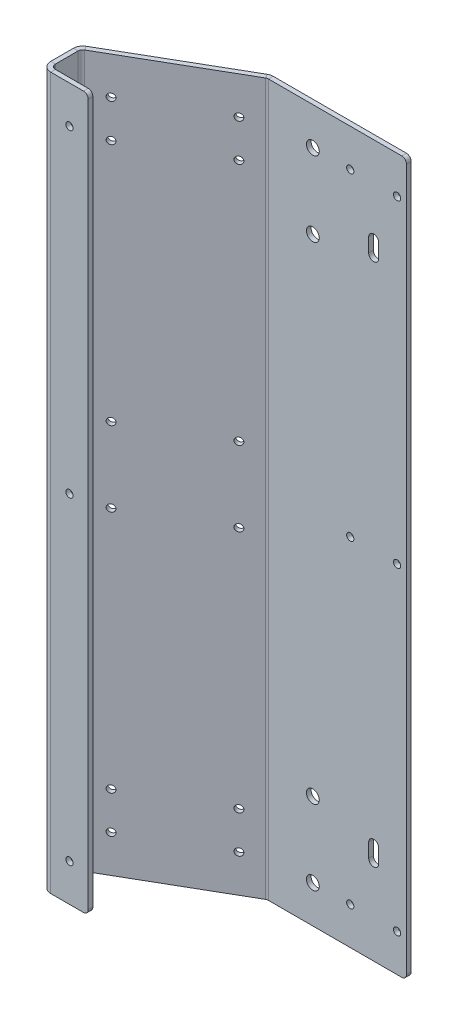
from build123d import *

# Parameters (mm, degrees)
BASE_FLANGE1_DEPTH = 482.6
SKETCH2_R          = 2.45745
CUT_EXTRUDE1_DEPTH = 3.175
SKETCH3_R          = 2.45745
CUT_EXTRUDE2_DEPTH = 3.175
SKETCH4_R          = 2.45745
CUT_EXTRUDE3_DEPTH = 3.175
SKETCH5_R          = 2.45745
SKETCH5_R_2        = 4.3688
CUT_EXTRUDE4_DEPTH = 3.175
FILLET1_R          = 3.175


# Sheet-metal steps are written as plain solids
with BuildPart() as part:
    # Sketch1 → Base-Flange1 (new body)
    with BuildSketch(Plane(origin=(0, 0, 0), x_dir=(1, 0, 0), z_dir=(0, 1, 0))):
        with BuildLine():
            Line((31.75, 0), (6.35, 0))
            ThreePointArc((6.35, 0), (1.859871939, 1.859871939), (0, 6.35))
            Line((0, 6.35), (0, 21.733825791))
            ThreePointArc((0, 21.733825791), (0.850738686, 24.908825791), (3.175, 27.233087105))
            Line((3.175, 27.233087105), (81.015397082, 72.174261314))
            ThreePointArc((81.015397082, 72.174261314), (82.546896146, 72.808628997), (84.190397082, 73.025))
            Line((84.190397082, 73.025), (177.8, 73.025))
            Line((177.8, 73.025), (177.8, 69.85))
            Line((177.8, 69.85), (84.190397082, 69.85))
            ThreePointArc((84.190397082, 69.85), (83.368646614, 69.741814498), (82.602897082, 69.424630657))
            Line((82.602897082, 69.424630657), (4.7625, 24.483456448))
            ThreePointArc((4.7625, 24.483456448), (3.600369343, 23.321325791), (3.175, 21.733825791))
            Line((3.175, 21.733825791), (3.175, 6.35))
            ThreePointArc((3.175, 6.35), (4.10493597, 4.10493597), (6.35, 3.175))
            Line((6.35, 3.175), (31.75, 3.175))
            Line((31.75, 3.175), (31.75, 0))
        make_face()
    extrude(amount=BASE_FLANGE1_DEPTH)

    # Sketch2 → Cut-Extrude1 (cut)
    with BuildSketch(Plane.XY):
        with Locations((19.05, 457.2)):
            Circle(SKETCH2_R)
        with Locations((19.05, 25.4)):
            Circle(SKETCH2_R)
        with Locations((19.05, 241.3)):
            Circle(SKETCH2_R)
    extrude(amount=-CUT_EXTRUDE1_DEPTH, mode=Mode.SUBTRACT)

    # Sketch3 → Cut-Extrude2 (cut)
    with BuildSketch(Plane.ZY):
        with Locations((-14.04239, 266.7)):
            Circle(SKETCH3_R)
        with Locations((-14.04239, 215.9)):
            Circle(SKETCH3_R)
    extrude(amount=-CUT_EXTRUDE2_DEPTH, mode=Mode.SUBTRACT)

    # Sketch4 → Cut-Extrude3 (cut)
    with BuildSketch(Plane(origin=(-10.998522628, 0, -19.05), x_dir=(-0.8660254037844397, 0, 0.4999999999999983), z_dir=(-0.4999999999999982, 0, -0.8660254037844396))):
        with Locations((-93.057032628, 25.4)):
            Circle(SKETCH4_R)
        with Locations((-29.557664209, 25.4)):
            Circle(SKETCH4_R)
        with Locations((-29.557664209, 50.8)):
            Circle(SKETCH4_R)
        with Locations((-93.057032628, 50.8)):
            Circle(SKETCH4_R)
        with Locations((-29.557664209, 431.8)):
            Circle(SKETCH4_R)
        with Locations((-29.557664209, 457.2)):
            Circle(SKETCH4_R)
        with Locations((-93.057032628, 457.2)):
            Circle(SKETCH4_R)
        with Locations((-93.057032628, 431.8)):
            Circle(SKETCH4_R)
        with Locations((-93.057032628, 215.9)):
            Circle(SKETCH4_R)
        with Locations((-29.557664209, 215.9)):
            Circle(SKETCH4_R)
        with Locations((-29.557664209, 266.7)):
            Circle(SKETCH4_R)
        with Locations((-93.057032628, 266.7)):
            Circle(SKETCH4_R)
    extrude(amount=-CUT_EXTRUDE3_DEPTH, mode=Mode.SUBTRACT)

    # Sketch5 → Cut-Extrude4 (cut)
    with BuildSketch(Plane(origin=(0, 0, -73.025), x_dir=(-1, 0, 0), z_dir=(0, 0, -1))):
        with Locations((-171.45, 457.2)):
            Circle(SKETCH5_R)
        with Locations((-139.7, 457.2)):
            Circle(SKETCH5_R)
        with Locations((-171.45, 25.4)):
            Circle(SKETCH5_R)
        with Locations((-139.7, 25.4)):
            Circle(SKETCH5_R)
        with Locations((-139.7, 241.3)):
            Circle(SKETCH5_R)
        with Locations((-171.45, 241.3)):
            Circle(SKETCH5_R)
        with Locations((-114.3, 457.2)):
            Circle(SKETCH5_R_2)
        with Locations((-114.3, 406.4)):
            Circle(SKETCH5_R_2)
        with Locations(Location((-114.3, 25.4, 0), (0, 0, 180))):
            Circle(SKETCH5_R_2)
        with Locations(Location((-114.3, 76.2, 0), (0, 0, 180))):
            Circle(SKETCH5_R_2)
        with BuildLine():
            Line((-158.9484375, 58.7375), (-158.9484375, 68.2625))
            ThreePointArc((-158.9484375, 68.2625), (-155.575, 71.6359375), (-152.2015625, 68.2625))
            Line((-152.2015625, 68.2625), (-152.2015625, 58.7375))
            ThreePointArc((-152.2015625, 58.7375), (-155.575, 55.3640625), (-158.9484375, 58.7375))
        make_face()
        with BuildLine():
            Line((-152.2015625, 423.8625), (-152.2015625, 414.3375))
            ThreePointArc((-152.2015625, 414.3375), (-155.575, 410.9640625), (-158.9484375, 414.3375))
            Line((-158.9484375, 414.3375), (-158.9484375, 423.8625))
            ThreePointArc((-158.9484375, 423.8625), (-155.575, 427.2359375), (-152.2015625, 423.8625))
        make_face()
    extrude(amount=-CUT_EXTRUDE4_DEPTH, mode=Mode.SUBTRACT)

    # Fillet1
    fillet1_edges = [part.edges().sort_by_distance(p)[0] for p in [
        (31.75, 0, -1.5875),
        (177.8, 0, -71.4375),
        (31.75, 482.6, -1.5875),
        (177.8, 482.6, -71.4375),
    ]]
    fillet(fillet1_edges, radius=FILLET1_R)


solid = part.part
